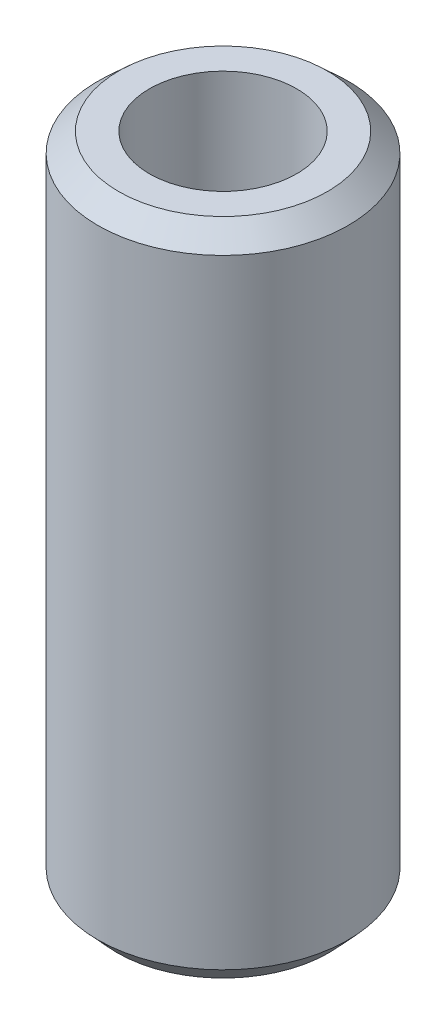
from build123d import *
from OCP.BRepFilletAPI import BRepFilletAPI_MakeChamfer

# Parameters (mm, degrees)
SKETCH1_R           = 10
BOSS_EXTRUDE1_DEPTH = 52.628320969
SKETCH2_R           = 5.889990357
CUT_EXTRUDE1_DEPTH  = 55.495322441
CHAMFER1_SIZE       = 1.525397257
CHAMFER1_SIZE2      = 1.651536599


with BuildPart() as part:
    # Sketch1 → Boss-Extrude1 (new body)
    with BuildSketch(Plane(origin=(0, 0, 0), x_dir=(1, 0, 0), z_dir=(0, 1, 0))):
        Circle(SKETCH1_R)
    extrude(amount=BOSS_EXTRUDE1_DEPTH)

    # Sketch2 → Cut-Extrude1 (cut, through all)
    with BuildSketch(Plane(origin=(0, 0, 0), x_dir=(1, 0, 0), z_dir=(0, 1, 0))):
        Circle(SKETCH2_R)
    extrude(amount=CUT_EXTRUDE1_DEPTH, mode=Mode.SUBTRACT)

    # Chamfer1: one chamfer whose edges measure the first distance from different faces: ONE call of the kernel's chamfer builder (chamfer() names one face for all edges)
    chamfer1_edges_1 = [part.edges().sort_by_distance(p)[0] for p in [
        (-10, 52.628320969, 0),
    ]]
    chamfer1_side_1 = [part.faces().sort_by_distance(p)[0] for p in [
        (-10, 26.314160484, 0),
    ]]
    chamfer1_edges_2 = [part.edges().sort_by_distance(p)[0] for p in [
        (-10, 0, 0),
    ]]
    chamfer1_side_2 = [part.faces().sort_by_distance(p)[0] for p in [
        (-9.717157288, 0, 0),
    ]]
    chamfer1 = BRepFilletAPI_MakeChamfer(part.part.solid().wrapped)
    for e in chamfer1_edges_1:
        chamfer1.Add(CHAMFER1_SIZE, CHAMFER1_SIZE2, e.wrapped, chamfer1_side_1[0].wrapped)  # the first distance lies on this face
    for e in chamfer1_edges_2:
        chamfer1.Add(CHAMFER1_SIZE, CHAMFER1_SIZE2, e.wrapped, chamfer1_side_2[0].wrapped)  # the first distance lies on this face
    add(Compound.cast(chamfer1.Shape()), mode=Mode.REPLACE)


solid = part.part
